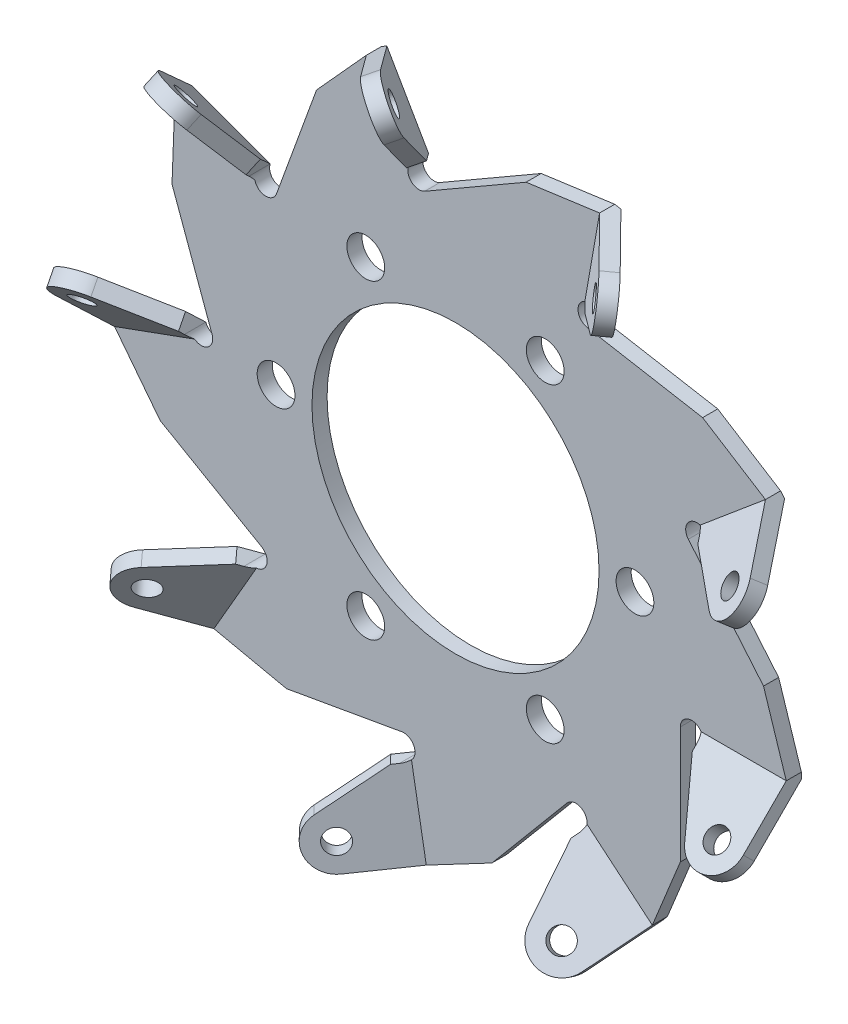
from build123d import *

# Parameters (mm, degrees)
SKETCH_7_R                          = 1.5
EXTRUDE_3_DEPTH                     = 2
PATTERN_CIRCULAR_1_COUNT            = 9
SKETCH_2_R                          = 50
SKETCH_2_R_2                        = 19
SKETCH_2_R_3                        = 2.5
EXTRUDE_1_DEPTH                     = 2
EXTRUDE_2_DEPTH                     = 2
SKETCH_4_R                          = 50
SKETCH_4_R_2                        = 46.106662127
CUT_EXTRUDE_1_DEPTH                 = 2
PATTERN_CIRCULAR_4_COUNT            = 9
OTHER_START                         = 25
OTHER_3_DEPTH                       = 7.880465325
CUT_EXTRUDE_4_REACH                 = 86.785
PATTERN_CIRCULAR_15_COUNT           = 9
CHAMFER_2_SIZE                      = 2
CUT_EXTRUDE_6_REACH                 = 86.785
PATTERN_CIRCULAR_17_COUNT           = 9
CUT_EXTRUDE_7_REACH                 = 86.785
PATTERN_CIRCULAR_19_COUNT           = 9
SKETCH_15_R                         = 8.026911935
CUT_EXTRUDE_9_DEPTH                 = 93.567160054
CUT_EXTRUDE_9_DRAFT                 = -5
PATTERN_CIRCULAR_26_COPY_1_SKETCH_R = 8.026911935
PATTERN_CIRCULAR_26_COPY_1_DEPTH    = 93.567160054
PATTERN_CIRCULAR_26_COPY_1_DRAFT    = -5
PATTERN_CIRCULAR_26_COPY_2_SKETCH_R = 8.026911935
PATTERN_CIRCULAR_26_COPY_2_DEPTH    = 93.567160054
PATTERN_CIRCULAR_26_COPY_2_DRAFT    = -5
PATTERN_CIRCULAR_26_COPY_3_SKETCH_R = 8.026911935
PATTERN_CIRCULAR_26_COPY_3_DEPTH    = 93.567160054
PATTERN_CIRCULAR_26_COPY_3_DRAFT    = -5
PATTERN_CIRCULAR_26_COPY_4_SKETCH_R = 8.026911935
PATTERN_CIRCULAR_26_COPY_4_DEPTH    = 93.567160054
PATTERN_CIRCULAR_26_COPY_4_DRAFT    = -5
PATTERN_CIRCULAR_26_COPY_5_SKETCH_R = 8.026911935
PATTERN_CIRCULAR_26_COPY_5_DEPTH    = 93.567160054
PATTERN_CIRCULAR_26_COPY_5_DRAFT    = -5
PATTERN_CIRCULAR_26_COPY_6_SKETCH_R = 8.026911935
PATTERN_CIRCULAR_26_COPY_6_DEPTH    = 93.567160054
PATTERN_CIRCULAR_26_COPY_6_DRAFT    = -5
PATTERN_CIRCULAR_26_COPY_7_SKETCH_R = 8.026911935
PATTERN_CIRCULAR_26_COPY_7_DEPTH    = 93.567160054
PATTERN_CIRCULAR_26_COPY_7_DRAFT    = -5
PATTERN_CIRCULAR_26_COPY_8_SKETCH_R = 8.026911935
PATTERN_CIRCULAR_26_COPY_8_DEPTH    = 93.567160054
PATTERN_CIRCULAR_26_COPY_8_DRAFT    = -5
SKETCH_14_R                         = 1.5
CUT_EXTRUDE_8_DEPTH                 = 82.855397957
PATTERN_CIRCULAR_27_COUNT           = 9
OTHER_START_2                       = 14.849242405
OTHER_4_OUTLINE_R                   = 2.5
OTHER_4_OUTLINE_R_2                 = 19
OTHER_4_DEPTH                       = 10.150757595


# Read off the part's stored shape, not the designer's step: 交差3, 交差4
with BuildPart() as part:
    # ｽｹｯﾁ1 → 回転1 (revolve)
    with BuildSketch(Plane(origin=(0, 0, 0), x_dir=(-1, 0, 0), z_dir=(0, 0.7071067811865488, 0.7071067811865464))):
        with BuildLine():
            Line((-47.157979176, 23.5), (-40.275, 23.5))
            Line((-40.275, 23.5), (-40.275, -23.5))
            Line((-40.275, -23.5), (-47.157979176, -23.5))
            add(Edge.make_bspline(
                [(-47.157979176, 23.5), (-53.013297933, 0), (-47.157979176, -23.5)],
                knots=[4.373605266, 4.373605266, 4.373605266, 5.051172695, 5.051172695, 5.051172695], degree=2, weights=[1, 0.943159584, 1]))
        make_face()
    revolve(axis=Axis((40.275, -16.617009358, 16.617009358), (0, 0.7071067811865462, -0.7071067811865489)))

    # ｽｹｯﾁ7 → ﾎﾞｽ - 押し出し3 (add)
    with BuildSketch(Plane(origin=(0, -16.617009358, 16.617009358), x_dir=(1, 0, 0), z_dir=(0, -0.7071067811865462, 0.7071067811865488))):
        with Locations(Location((40.275, 0, 0), (0, 0, 270))):
            Circle(SKETCH_7_R)
    extrude_3 = extrude(amount=EXTRUDE_3_DEPTH)

    # ﾐﾗｰ1: ﾎﾞｽ - 押し出し3 across plane
    add(extrude_3.mirror(Plane(origin=(0, 0, 0), x_dir=(0, 0.7071067811865488, 0.7071067811865464), z_dir=(0, -0.7071067811865462, 0.7071067811865488))))


with BuildPart() as pattern_circular_1_1:
    # 円形ﾊﾟﾀｰﾝ1: pattern copy
    add(part.part.rotate(Axis((0, 0, -25.842985085), (0, 0, 1)), 1 * 360 / PATTERN_CIRCULAR_1_COUNT))


with BuildPart() as pattern_circular_1_2:
    # 円形ﾊﾟﾀｰﾝ1: pattern copy
    add(part.part.rotate(Axis((0, 0, -25.842985085), (0, 0, 1)), 2 * 360 / PATTERN_CIRCULAR_1_COUNT))


with BuildPart() as pattern_circular_1_3:
    # 円形ﾊﾟﾀｰﾝ1: pattern copy
    add(part.part.rotate(Axis((0, 0, -25.842985085), (0, 0, 1)), 3 * 360 / PATTERN_CIRCULAR_1_COUNT))


with BuildPart() as pattern_circular_1_4:
    # 円形ﾊﾟﾀｰﾝ1: pattern copy
    add(part.part.rotate(Axis((0, 0, -25.842985085), (0, 0, 1)), 4 * 360 / PATTERN_CIRCULAR_1_COUNT))


with BuildPart() as pattern_circular_1_5:
    # 円形ﾊﾟﾀｰﾝ1: pattern copy
    add(part.part.rotate(Axis((0, 0, -25.842985085), (0, 0, 1)), 5 * 360 / PATTERN_CIRCULAR_1_COUNT))


with BuildPart() as pattern_circular_1_6:
    # 円形ﾊﾟﾀｰﾝ1: pattern copy
    add(part.part.rotate(Axis((0, 0, -25.842985085), (0, 0, 1)), 6 * 360 / PATTERN_CIRCULAR_1_COUNT))


with BuildPart() as pattern_circular_1_7:
    # 円形ﾊﾟﾀｰﾝ1: pattern copy
    add(part.part.rotate(Axis((0, 0, -25.842985085), (0, 0, 1)), 7 * 360 / PATTERN_CIRCULAR_1_COUNT))


with BuildPart() as pattern_circular_1_8:
    # 円形ﾊﾟﾀｰﾝ1: pattern copy
    add(part.part.rotate(Axis((0, 0, -25.842985085), (0, 0, 1)), 8 * 360 / PATTERN_CIRCULAR_1_COUNT))


with BuildPart() as body_10:
    # ｽｹｯﾁ2 → ﾎﾞｽ - 押し出し1 (new body)
    with BuildSketch(Plane.XY.offset(25)):
        Circle(SKETCH_2_R)
        Circle(SKETCH_2_R_2, mode=Mode.SUBTRACT)
        with Locations((-23.75, 0)):
            Circle(SKETCH_2_R_3, mode=Mode.SUBTRACT)
        with Locations((-11.875, 20.56810334)):
            Circle(SKETCH_2_R_3, mode=Mode.SUBTRACT)
        with Locations((11.875, 20.56810334)):
            Circle(SKETCH_2_R_3, mode=Mode.SUBTRACT)
        with Locations((23.75, 0)):
            Circle(SKETCH_2_R_3, mode=Mode.SUBTRACT)
        with Locations((11.875, -20.56810334)):
            Circle(SKETCH_2_R_3, mode=Mode.SUBTRACT)
        with Locations((-11.875, -20.56810334)):
            Circle(SKETCH_2_R_3, mode=Mode.SUBTRACT)
    extrude(amount=-EXTRUDE_1_DEPTH)

    # ｽｹｯﾁ3 → ﾎﾞｽ - 押し出し2 (add)
    with BuildSketch(Plane(origin=(0, -17.324116139, 17.324116139), x_dir=(1, 0, 0), z_dir=(0, -0.7071067811865462, 0.7071067811865488))):
        with BuildLine():
            Line((37.243911087, -1.75), (24.686542732, 20))
            Line((24.686542732, 20), (43.775, 20))
            Line((43.775, 20), (43.775, 0))
            ThreePointArc((43.775, 0), (41.180866658, -3.380740392), (37.243911087, -1.75))
        make_face()
    extrude_2 = extrude(amount=EXTRUDE_2_DEPTH)

    # ｽｹｯﾁ4 → ｶｯﾄ - 押し出し1 (cut)
    with BuildSketch(Plane.XY.offset(25)):
        Circle(SKETCH_4_R)
        Circle(SKETCH_4_R_2, mode=Mode.SUBTRACT)
    extrude(amount=-CUT_EXTRUDE_1_DEPTH, mode=Mode.SUBTRACT)

    # 円形ﾊﾟﾀｰﾝ4: ﾎﾞｽ - 押し出し2 ×9 about axis
    pattern_circular_4_axis = Axis((0, 0, 0), (0, 0, 1))
    for i in range(1, PATTERN_CIRCULAR_4_COUNT):
        add(extrude_2.rotate(pattern_circular_4_axis, i * 360 / PATTERN_CIRCULAR_4_COUNT))

    # Combine 1: union part, 円形ﾊﾟﾀｰﾝ1_1, 円形ﾊﾟﾀｰﾝ1_2, 円形ﾊﾟﾀｰﾝ1_3, 円形ﾊﾟﾀｰﾝ1_4, 円形ﾊﾟﾀｰﾝ1_6, 円形ﾊﾟﾀｰﾝ1_5, 円形ﾊﾟﾀｰﾝ1_8, 円形ﾊﾟﾀｰﾝ1_7
    add(part.part)
    add(pattern_circular_1_1.part)
    add(pattern_circular_1_2.part)
    add(pattern_circular_1_3.part)
    add(pattern_circular_1_4.part)
    add(pattern_circular_1_6.part)
    add(pattern_circular_1_5.part)
    add(pattern_circular_1_8.part)
    add(pattern_circular_1_7.part)

    # 交差3 outline → 交差3 (cut)
    with BuildSketch(Plane.XY.offset(OTHER_START)):
        Polygon((43.775, -15.932797006), (43.775, 15.932797006), (41.553437572, 18.58035201), (35.578933147, 25.700489122), (23.292190994, 40.343258223), (19.888559889, 40.943410219), (10.735088059, 42.55741427), (-8.08929304, 45.876660553), (-11.082396003, 44.148591752), (-19.131824039, 39.501252308), (-35.685706961, 29.943863546), (-36.867775638, 26.696156547), (-40.046743043, 17.962015384), (-46.58438199, 0), (-45.402313312, -3.247707001), (-42.223345907, -11.981848164), (-35.685706961, -29.943863547), (-32.692603997, -31.671932349), (-8.089293042, -45.876660554), (-4.685661934, -45.276508557), (4.467809896, -43.662504506), (23.292190995, -40.343258223), (25.513753423, -37.695703218), (31.488257848, -30.575566106), align=None)
    extrude(amount=OTHER_3_DEPTH, mode=Mode.SUBTRACT)

    # ｽｹｯﾁ9 → ｶｯﾄ - 押し出し4 (cut, up to next)
    with BuildSketch(Plane.XY.offset(25), mode=Mode.PRIVATE) as cut_extrude_4_sk1:
        with BuildLine():
            Line((43.775, -14.476659403), (32.753908888, -14.476659403))
            Line((32.753908888, -14.476659403), (32.753908888, -32.45005))
            ThreePointArc((32.753908888, -32.45005), (39.30558696, -24.101766039), (43.775, -14.476659403))
        make_face()
    cut_extrude_4_tool1 = extrude(cut_extrude_4_sk1.sketch, amount=-CUT_EXTRUDE_4_REACH, mode=Mode.PRIVATE) & body_10.part
    # ｽｹｯﾁ9 → ｶｯﾄ - 押し出し4 (cut, up to next)
    with BuildSketch(Plane.XY.offset(25), mode=Mode.PRIVATE) as cut_extrude_4_sk2:
        with BuildLine():
            Line((43.775, 14.476659403), (43.775, -14.476659403))
            ThreePointArc((43.775, -14.476659403), (45.520014428, -7.331615029), (46.106662127, 0))
            ThreePointArc((46.106662127, 0), (45.520014428, 7.331615029), (43.775, 14.476659403))
        make_face()
    cut_extrude_4_tool2 = extrude(cut_extrude_4_sk2.sketch, amount=-CUT_EXTRUDE_4_REACH, mode=Mode.PRIVATE) & body_10.part
    cut_extrude_4_1 = cut_extrude_4_tool1.solids().sort_by_distance((36.761282, -20.949139, 25))[0]
    add(cut_extrude_4_1, mode=Mode.SUBTRACT)
    cut_extrude_4_2 = cut_extrude_4_tool2.solids().sort_by_distance((44.709716, 0, 25))[0]
    add(cut_extrude_4_2, mode=Mode.SUBTRACT)
    cut_extrude_4 = cut_extrude_4_1 + cut_extrude_4_2  # ｶｯﾄ - 押し出し4 as one shape, for the pattern or mirror that repeats it

    # 円形ﾊﾟﾀｰﾝ15: ｶｯﾄ - 押し出し4 ×9 about axis
    pattern_circular_15_axis = Axis((0, 0, 0), (0, 0, 1))
    for i in range(1, PATTERN_CIRCULAR_15_COUNT):
        add(cut_extrude_4.rotate(pattern_circular_15_axis, i * 360 / PATTERN_CIRCULAR_15_COUNT), mode=Mode.SUBTRACT)

    # 面取り2
    chamfer_2_edges = [body_10.edges().sort_by_distance(p)[0] for p in [
        (-40.908134603, 0.516395821, 25),
        (-31.669382027, -25.899659909, 25),
        (-7.612173634, -40.196976925, 25),
        (20.006855402, -35.685681698, 25),
        (38.264454444, -14.476659403, 25),
        (38.61768999, 13.506152717, 25),
        (20.901279201, 35.169285877, 25),
        (-6.595072417, 40.376319312, 25),
        (-31.005516356, 26.690824208, 25),
    ]]
    chamfer(chamfer_2_edges, length=CHAMFER_2_SIZE - 0.0001)  # a hair under: the kernel refuses the full size

    # ｽｹｯﾁ11 → ｶｯﾄ - 押し出し6 (cut, up to next)
    with BuildSketch(Plane.XY.offset(25), mode=Mode.PRIVATE) as cut_extrude_6_sk1:
        with BuildLine():
            Line((-5.571850447, 34.604046872), (11.892264826, 44.686958525))
            ThreePointArc((11.892264826, 44.686958525), (13.941302931, 44.137920419), (13.392264826, 42.088882314))
            Line((13.392264826, 42.088882314), (-4.071850447, 32.00597066))
            ThreePointArc((-4.071850447, 32.00597066), (-6.120888552, 32.555008766), (-5.571850447, 34.604046872))
        make_face()
    cut_extrude_6_tool1 = extrude(cut_extrude_6_sk1.sketch, amount=-CUT_EXTRUDE_6_REACH, mode=Mode.PRIVATE) & body_10.part
    cut_extrude_6 = cut_extrude_6_tool1.solids().sort_by_distance((3.910207, 38.346465, 25))[0]
    add(cut_extrude_6, mode=Mode.SUBTRACT)

    # 円形ﾊﾟﾀｰﾝ17: ｶｯﾄ - 押し出し6 ×9 about axis
    pattern_circular_17_axis = Axis((0, 0, 0), (0, 0, 1))
    for i in range(1, PATTERN_CIRCULAR_17_COUNT):
        add(cut_extrude_6.rotate(pattern_circular_17_axis, i * 360 / PATTERN_CIRCULAR_17_COUNT), mode=Mode.SUBTRACT)

    # ｽｹｯﾁ13 → ｶｯﾄ - 押し出し7 (cut, up to next)
    with BuildSketch(Plane.XY.offset(25), mode=Mode.PRIVATE) as cut_extrude_7_sk1:
        Polygon((19.072718434, 41.08726508), (13.392264826, 42.088882314), (9.338467933, 39.748421587), align=None)
    cut_extrude_7_tool1 = extrude(cut_extrude_7_sk1.sketch, amount=-CUT_EXTRUDE_7_REACH, mode=Mode.PRIVATE) & body_10.part
    cut_extrude_7 = cut_extrude_7_tool1.solids().sort_by_distance((13.934484, 40.974856, 25))[0]
    add(cut_extrude_7, mode=Mode.SUBTRACT)

    # 円形ﾊﾟﾀｰﾝ19: ｶｯﾄ - 押し出し7 ×9 about axis
    pattern_circular_19_axis = Axis((0, 0, 0), (0, 0, 1))
    for i in range(1, PATTERN_CIRCULAR_19_COUNT):
        add(cut_extrude_7.rotate(pattern_circular_19_axis, i * 360 / PATTERN_CIRCULAR_19_COUNT), mode=Mode.SUBTRACT)


with BuildPart() as cut_extrude_9_tool:
    # ｽｹｯﾁ15 → ｶｯﾄ - 押し出し9 (with draft: the straight prism first)
    with BuildSketch(Plane(origin=(0, -17.324116139, 17.324116139), x_dir=(1, 0, 0), z_dir=(0, 0.7071067811865462, -0.7071067811865488))):
        with Locations((40.275, 0)):
            Circle(SKETCH_15_R)
    extrude(amount=CUT_EXTRUDE_9_DEPTH)
    # ｶｯﾄ - 押し出し9: the draft: its side faces are tilted about the plane it starts from
    cut_extrude_9_sides = [cut_extrude_9_tool.faces().sort_by_distance(p)[0] for p in [
        (32.248088065, 15.756870546, -15.756870546),
    ]]
    draft(cut_extrude_9_sides, Plane(origin=(0, -17.324116139, 17.324116139), x_dir=(1, 0, 0), z_dir=(0, 0.7071067811865462, -0.7071067811865488)), CUT_EXTRUDE_9_DRAFT)


with BuildPart() as body_10_1:
    add(body_10.part)

    # ｶｯﾄ - 押し出し9: cut by cut_extrude_9_tool
    add(cut_extrude_9_tool.part, mode=Mode.SUBTRACT)


with BuildPart() as pattern_circular_26_copy_1_tool:
    # 円形ﾊﾟﾀｰﾝ26 copy 1 sketch → 円形ﾊﾟﾀｰﾝ26 copy 1 (with draft: the straight prism first)
    with BuildSketch(Plane(origin=(11.135727203, -13.2710429, 17.324116139), x_dir=(0.766044443118978, 0.6427876096865393, 0), z_dir=(-0.4545194776720428, 0.5416752204197008, -0.7071067811865488))):
        with Locations((40.275, 0)):
            Circle(PATTERN_CIRCULAR_26_COPY_1_SKETCH_R)
    extrude(amount=PATTERN_CIRCULAR_26_COPY_1_DEPTH)
    # 円形ﾊﾟﾀｰﾝ26 copy 1: the draft: its side faces are tilted about the plane it starts from
    pattern_circular_26_copy_1_sides = [pattern_circular_26_copy_1_tool.faces().sort_by_distance(p)[0] for p in [
        (14.575147509, 32.799134567, -15.756870546),
    ]]
    draft(pattern_circular_26_copy_1_sides, Plane(origin=(11.135727203, -13.2710429, 17.324116139), x_dir=(0.766044443118978, 0.6427876096865393, 0), z_dir=(-0.4545194776720428, 0.5416752204197008, -0.7071067811865488)), PATTERN_CIRCULAR_26_COPY_1_DRAFT)


with BuildPart() as body_10_2:
    add(body_10_1.part)

    # 円形ﾊﾟﾀｰﾝ26 copy 1: cut by pattern_circular_26_copy_1_tool
    add(pattern_circular_26_copy_1_tool.part, mode=Mode.SUBTRACT)


with BuildPart() as pattern_circular_26_copy_2_tool:
    # 円形ﾊﾟﾀｰﾝ26 copy 2 sketch → 円形ﾊﾟﾀｰﾝ26 copy 2 (with draft: the straight prism first)
    with BuildSketch(Plane(origin=(17.060923888, -3.008301197, 17.324116139), x_dir=(0.17364817766693041, 0.984807753012208, 0), z_dir=(-0.6963642403200176, 0.12278780396897267, -0.7071067811865488))):
        with Locations((40.275, 0)):
            Circle(PATTERN_CIRCULAR_26_COPY_2_SKETCH_R)
    extrude(amount=PATTERN_CIRCULAR_26_COPY_2_DEPTH)
    # 円形ﾊﾟﾀｰﾝ26 copy 2: the draft: its side faces are tilted about the plane it starts from
    pattern_circular_26_copy_2_sides = [pattern_circular_26_copy_2_tool.faces().sort_by_distance(p)[0] for p in [
        (-9.917666551, 34.494319002, -15.756870546),
    ]]
    draft(pattern_circular_26_copy_2_sides, Plane(origin=(17.060923888, -3.008301197, 17.324116139), x_dir=(0.17364817766693041, 0.984807753012208, 0), z_dir=(-0.6963642403200176, 0.12278780396897267, -0.7071067811865488)), PATTERN_CIRCULAR_26_COPY_2_DRAFT)


with BuildPart() as body_10_3:
    add(body_10_2.part)

    # 円形ﾊﾟﾀｰﾝ26 copy 2: cut by pattern_circular_26_copy_2_tool
    add(pattern_circular_26_copy_2_tool.part, mode=Mode.SUBTRACT)


with BuildPart() as pattern_circular_26_copy_3_tool:
    # 円形ﾊﾟﾀｰﾝ26 copy 3 sketch → 円形ﾊﾟﾀｰﾝ26 copy 3 (with draft: the straight prism first)
    with BuildSketch(Plane(origin=(15.003124675, 8.66205807, 17.324116139), x_dir=(-0.4999999999999998, 0.8660254037844387, 0), z_dir=(-0.6123724356957935, -0.35355339059327295, -0.7071067811865488))):
        with Locations((40.275, 0)):
            Circle(PATTERN_CIRCULAR_26_COPY_3_SKETCH_R)
    extrude(amount=PATTERN_CIRCULAR_26_COPY_3_DEPTH)
    # 円形ﾊﾟﾀｰﾝ26 copy 3: the draft: its side faces are tilted about the plane it starts from
    pattern_circular_26_copy_3_sides = [pattern_circular_26_copy_3_tool.faces().sort_by_distance(p)[0] for p in [
        (-29.769894209, 20.049228215, -15.756870546),
    ]]
    draft(pattern_circular_26_copy_3_sides, Plane(origin=(15.003124675, 8.66205807, 17.324116139), x_dir=(-0.4999999999999998, 0.8660254037844387, 0), z_dir=(-0.6123724356957935, -0.35355339059327295, -0.7071067811865488)), PATTERN_CIRCULAR_26_COPY_3_DRAFT)


with BuildPart() as body_10_4:
    add(body_10_3.part)

    # 円形ﾊﾟﾀｰﾝ26 copy 3: cut by pattern_circular_26_copy_3_tool
    add(pattern_circular_26_copy_3_tool.part, mode=Mode.SUBTRACT)


with BuildPart() as pattern_circular_26_copy_4_tool:
    # 円形ﾊﾟﾀｰﾝ26 copy 4 sketch → 円形ﾊﾟﾀｰﾝ26 copy 4 (with draft: the straight prism first)
    with BuildSketch(Plane(origin=(5.925196685, 16.279344098, 17.324116139), x_dir=(-0.9396926207859083, 0.3420201433256689, 0), z_dir=(-0.24184476264797491, -0.6644630243886734, -0.7071067811865488))):
        with Locations((40.275, 0)):
            Circle(PATTERN_CIRCULAR_26_COPY_4_SKETCH_R)
    extrude(amount=PATTERN_CIRCULAR_26_COPY_4_DEPTH)
    # 円形ﾊﾟﾀｰﾝ26 copy 4: the draft: its side faces are tilted about the plane it starts from
    pattern_circular_26_copy_4_sides = [pattern_circular_26_copy_4_tool.faces().sort_by_distance(p)[0] for p in [
        (-35.692457512, -3.777119277, -15.756870546),
    ]]
    draft(pattern_circular_26_copy_4_sides, Plane(origin=(5.925196685, 16.279344098, 17.324116139), x_dir=(-0.9396926207859083, 0.3420201433256689, 0), z_dir=(-0.24184476264797491, -0.6644630243886734, -0.7071067811865488)), PATTERN_CIRCULAR_26_COPY_4_DRAFT)


with BuildPart() as body_10_5:
    add(body_10_4.part)

    # 円形ﾊﾟﾀｰﾝ26 copy 4: cut by pattern_circular_26_copy_4_tool
    add(pattern_circular_26_copy_4_tool.part, mode=Mode.SUBTRACT)


with BuildPart() as pattern_circular_26_copy_5_tool:
    # 円形ﾊﾟﾀｰﾝ26 copy 5 sketch → 円形ﾊﾟﾀｰﾝ26 copy 5 (with draft: the straight prism first)
    with BuildSketch(Plane(origin=(-5.925196685, 16.279344098, 17.324116139), x_dir=(-0.9396926207859084, -0.34202014332566866, 0), z_dir=(0.24184476264797478, -0.6644630243886736, -0.7071067811865488))):
        with Locations((40.275, 0)):
            Circle(PATTERN_CIRCULAR_26_COPY_5_SKETCH_R)
    extrude(amount=PATTERN_CIRCULAR_26_COPY_5_DEPTH)
    # 円形ﾊﾟﾀｰﾝ26 copy 5: the draft: its side faces are tilted about the plane it starts from
    pattern_circular_26_copy_5_sides = [pattern_circular_26_copy_5_tool.faces().sort_by_distance(p)[0] for p in [
        (-24.914123267, -25.836110681, -15.756870546),
    ]]
    draft(pattern_circular_26_copy_5_sides, Plane(origin=(-5.925196685, 16.279344098, 17.324116139), x_dir=(-0.9396926207859084, -0.34202014332566866, 0), z_dir=(0.24184476264797478, -0.6644630243886736, -0.7071067811865488)), PATTERN_CIRCULAR_26_COPY_5_DRAFT)


with BuildPart() as body_10_6:
    add(body_10_5.part)

    # 円形ﾊﾟﾀｰﾝ26 copy 5: cut by pattern_circular_26_copy_5_tool
    add(pattern_circular_26_copy_5_tool.part, mode=Mode.SUBTRACT)


with BuildPart() as pattern_circular_26_copy_6_tool:
    # 円形ﾊﾟﾀｰﾝ26 copy 6 sketch → 円形ﾊﾟﾀｰﾝ26 copy 6 (with draft: the straight prism first)
    with BuildSketch(Plane(origin=(-15.003124675, 8.66205807, 17.324116139), x_dir=(-0.5000000000000004, -0.8660254037844384, 0), z_dir=(0.6123724356957932, -0.35355339059327345, -0.7071067811865488))):
        with Locations((40.275, 0)):
            Circle(PATTERN_CIRCULAR_26_COPY_6_SKETCH_R)
    extrude(amount=PATTERN_CIRCULAR_26_COPY_6_DEPTH)
    # 円形ﾊﾟﾀｰﾝ26 copy 6: the draft: its side faces are tilted about the plane it starts from
    pattern_circular_26_copy_6_sides = [pattern_circular_26_copy_6_tool.faces().sort_by_distance(p)[0] for p in [
        (-2.478193856, -35.806098761, -15.756870546),
    ]]
    draft(pattern_circular_26_copy_6_sides, Plane(origin=(-15.003124675, 8.66205807, 17.324116139), x_dir=(-0.5000000000000004, -0.8660254037844384, 0), z_dir=(0.6123724356957932, -0.35355339059327345, -0.7071067811865488)), PATTERN_CIRCULAR_26_COPY_6_DRAFT)


with BuildPart() as body_10_7:
    add(body_10_6.part)

    # 円形ﾊﾟﾀｰﾝ26 copy 6: cut by pattern_circular_26_copy_6_tool
    add(pattern_circular_26_copy_6_tool.part, mode=Mode.SUBTRACT)


with BuildPart() as pattern_circular_26_copy_7_tool:
    # 円形ﾊﾟﾀｰﾝ26 copy 7 sketch → 円形ﾊﾟﾀｰﾝ26 copy 7 (with draft: the straight prism first)
    with BuildSketch(Plane(origin=(-17.060923888, -3.008301197, 17.324116139), x_dir=(0.17364817766692997, -0.9848077530122081, 0), z_dir=(0.6963642403200178, 0.12278780396897236, -0.7071067811865488))):
        with Locations((40.275, 0)):
            Circle(PATTERN_CIRCULAR_26_COPY_7_SKETCH_R)
    extrude(amount=PATTERN_CIRCULAR_26_COPY_7_DEPTH)
    # 円形ﾊﾟﾀｰﾝ26 copy 7: the draft: its side faces are tilted about the plane it starts from
    pattern_circular_26_copy_7_sides = [pattern_circular_26_copy_7_tool.faces().sort_by_distance(p)[0] for p in [
        (21.117310003, -29.02201529, -15.756870546),
    ]]
    draft(pattern_circular_26_copy_7_sides, Plane(origin=(-17.060923888, -3.008301197, 17.324116139), x_dir=(0.17364817766692997, -0.9848077530122081, 0), z_dir=(0.6963642403200178, 0.12278780396897236, -0.7071067811865488)), PATTERN_CIRCULAR_26_COPY_7_DRAFT)


with BuildPart() as body_10_8:
    add(body_10_7.part)

    # 円形ﾊﾟﾀｰﾝ26 copy 7: cut by pattern_circular_26_copy_7_tool
    add(pattern_circular_26_copy_7_tool.part, mode=Mode.SUBTRACT)


with BuildPart() as pattern_circular_26_copy_8_tool:
    # 円形ﾊﾟﾀｰﾝ26 copy 8 sketch → 円形ﾊﾟﾀｰﾝ26 copy 8 (with draft: the straight prism first)
    with BuildSketch(Plane(origin=(-11.135727203, -13.2710429, 17.324116139), x_dir=(0.7660444431189778, -0.6427876096865396, 0), z_dir=(0.45451947767204304, 0.5416752204197007, -0.7071067811865488))):
        with Locations((40.275, 0)):
            Circle(PATTERN_CIRCULAR_26_COPY_8_SKETCH_R)
    extrude(amount=PATTERN_CIRCULAR_26_COPY_8_DEPTH)
    # 円形ﾊﾟﾀｰﾝ26 copy 8: the draft: its side faces are tilted about the plane it starts from
    pattern_circular_26_copy_8_sides = [pattern_circular_26_copy_8_tool.faces().sort_by_distance(p)[0] for p in [
        (34.831789818, -8.658208322, -15.756870546),
    ]]
    draft(pattern_circular_26_copy_8_sides, Plane(origin=(-11.135727203, -13.2710429, 17.324116139), x_dir=(0.7660444431189778, -0.6427876096865396, 0), z_dir=(0.45451947767204304, 0.5416752204197007, -0.7071067811865488)), PATTERN_CIRCULAR_26_COPY_8_DRAFT)


with BuildPart() as body_10_9:
    add(body_10_8.part)

    # 円形ﾊﾟﾀｰﾝ26 copy 8: cut by pattern_circular_26_copy_8_tool
    add(pattern_circular_26_copy_8_tool.part, mode=Mode.SUBTRACT)

    # ｽｹｯﾁ14 → ｶｯﾄ - 押し出し8 (cut, through all)
    with BuildSketch(Plane(origin=(0, -18.738329701, 18.738329701), x_dir=(1, 0, 0), z_dir=(0, -0.7071067811865462, 0.7071067811865488))):
        with Locations(Location((40.275, 0, 0), (0, 0, 270))):
            Circle(SKETCH_14_R)
    cut_extrude_8 = extrude(amount=-CUT_EXTRUDE_8_DEPTH, mode=Mode.SUBTRACT)

    # 円形ﾊﾟﾀｰﾝ27: ｶｯﾄ - 押し出し8 ×9 about axis
    pattern_circular_27_axis = Axis((0, 0, -25.842985085), (0, 0, 1))
    for i in range(1, PATTERN_CIRCULAR_27_COUNT):
        add(cut_extrude_8.rotate(pattern_circular_27_axis, i * 360 / PATTERN_CIRCULAR_27_COUNT), mode=Mode.SUBTRACT)

    # ﾐﾗｰ2: body 10 across plane


with BuildPart() as body_10_10:
    add(body_10_9.part)
    add(body_10_9.part.mirror(Plane.XY.offset(25)))

    # 交差4 outline → 交差4 (cut)
    with BuildSketch(Plane.XY.offset(OTHER_START_2)):
        with BuildLine():
            Line((21.488829339, -42.492420955), (26.046256114, -37.061091223))
            Line((26.046256114, -37.061091223), (29.753908888, -27.961561256))
            Line((29.753908888, -27.961561256), (29.753908888, -12.476659403))
            ThreePointArc((29.753908888, -12.476659403), (31.253908888, -10.976659403), (32.753908888, -12.476659403))
            Line((32.753908888, -12.476659403), (32.753908888, -48))
            Line((32.753908888, -48), (43.775, -48))
            Line((43.775, -48), (43.775, -11.648232278))
            Line((43.775, -11.648232278), (40.766161688, -2.294354648))
            Line((40.766161688, -2.294354648), (30.812658639, 9.567768369))
            ThreePointArc((30.812658639, 9.567768369), (30.997543889, 11.681016448), (33.110791968, 11.496131198))
            Line((33.110791968, 11.496131198), (34.396367188, 9.964042311))
            Line((34.396367188, 9.964042311), (48, -6.248135965))
            Line((48, -6.248135965), (48, 10.897638077))
            Line((48, 10.897638077), (45.578361656, 13.783634273))
            Line((45.578361656, 13.783634273), (41.020934881, 19.214964005))
            Line((41.020934881, 19.214964005), (32.703474368, 24.446405998))
            Line((32.703474368, 24.446405998), (17.453822969, 27.135330987))
            ThreePointArc((17.453822969, 27.135330987), (16.237083605, 28.873014883), (17.974767502, 30.089754246))
            Line((17.974767502, 30.089754246), (19.944383008, 29.74245789))
            Line((19.944383008, 29.74245789), (48, 24.795495644))
            Line((48, 24.795495644), (48, 35.986604861))
            Line((48, 35.986604861), (26.055101346, 39.856082583))
            Line((26.055101346, 39.856082583), (19.072718434, 41.08726508))
            Line((19.072718434, 41.08726508), (9.338467933, 39.748421587))
            Line((9.338467933, 39.748421587), (-4.071850447, 32.00597066))
            ThreePointArc((-4.071850447, 32.00597066), (-6.120888552, 32.555008766), (-5.571850447, 34.604046872))
            Line((-5.571850447, 34.604046872), (-3.839799639, 35.604046872))
            Line((-3.839799639, 35.604046872), (19.3626718, 49))
            Line((19.3626718, 49), (-2.679510428, 49))
            Line((-2.679510428, 49), (-5.659630454, 47.279426901))
            Line((-5.659630454, 47.279426901), (-11.799834938, 43.73437819))
            Line((-11.799834938, 43.73437819), (-18.396111433, 36.45170896))
            Line((-18.396111433, 36.45170896), (-23.692259784, 21.900660955))
            ThreePointArc((-23.692259784, 21.900660955), (-25.61482893, 21.004152239), (-26.511337647, 22.926721385))
            Line((-26.511337647, 22.926721385), (-25.82729736, 24.806106627))
            Line((-25.82729736, 24.806106627), (-17.021440319, 49))
            Line((-17.021440319, 49), (-28.749840511, 49))
            Line((-28.749840511, 49), (-34.726158265, 32.58020192))
            Line((-34.726158265, 32.58020192), (-37.151114402, 25.917689691))
            Line((-37.151114402, 25.917689691), (-37.52294581, 16.098836596))
            Line((-37.52294581, 16.098836596), (-32.226797459, 1.547788591))
            ThreePointArc((-32.226797459, 1.547788591), (-33.123306175, -0.374780556), (-35.045875321, 0.521728161))
            Line((-35.045875321, 0.521728161), (-35.729915608, 2.401113402))
            Line((-35.729915608, 2.401113402), (-49, 38.860370594))
            Line((-49, 38.860370594), (-49, 6.636855936))
            Line((-49, 6.636855936), (-47.543930685, 2.636338372))
            Line((-47.543930685, 2.636338372), (-45.118974548, -4.026173857))
            Line((-45.118974548, -4.026173857), (-39.092376821, -11.786860331))
            Line((-39.092376821, -11.786860331), (-25.682058441, -19.529311257))
            ThreePointArc((-25.682058441, -19.529311257), (-25.133020336, -21.578349363), (-27.182058441, -22.127387469))
            Line((-27.182058441, -22.127387469), (-28.914109249, -21.127387469))
            Line((-28.914109249, -21.127387469), (-49, -9.53079304))
            Line((-49, -9.53079304), (-49, -22.256852877))
            Line((-49, -22.256852877), (-38.115369546, -28.5410972))
            Line((-38.115369546, -28.5410972), (-31.975165062, -32.086145912))
            Line((-31.975165062, -32.086145912), (-22.370050255, -34.157354312))
            Line((-22.370050255, -34.157354312), (-7.120398855, -31.468429324))
            ThreePointArc((-7.120398855, -31.468429324), (-5.382714959, -32.685168687), (-6.599454322, -34.422852583))
            Line((-6.599454322, -34.422852583), (-8.569069828, -34.770148938))
            Line((-8.569069828, -34.770148938), (-49, -41.899212776))
            Line((-49, -41.899212776), (-49, -48))
            Line((-49, -48), (-20.131349444, -48))
            Line((-20.131349444, -48), (-10.852203391, -46.363836193))
            Line((-10.852203391, -46.363836193), (-3.869820479, -45.132653696))
            Line((-3.869820479, -45.132653696), (4.819471442, -40.545242594))
            Line((4.819471442, -40.545242594), (14.77297449, -28.683119577))
            ThreePointArc((14.77297449, -28.683119577), (16.886222569, -28.498234327), (17.07110782, -30.611482406))
            Line((17.07110782, -30.611482406), (15.7855326, -32.143571292))
            Line((15.7855326, -32.143571292), (2.480409111, -48))
            Line((2.480409111, -48), (16.867421794, -48))
            Line((16.867421794, -48), (21.488829339, -42.492420955))
        make_face()
        with Locations((-11.875, -20.56810334)):
            Circle(OTHER_4_OUTLINE_R, mode=Mode.SUBTRACT)
        with Locations((-23.75, 0)):
            Circle(OTHER_4_OUTLINE_R, mode=Mode.SUBTRACT)
        with Locations((11.875, -20.56810334)):
            Circle(OTHER_4_OUTLINE_R, mode=Mode.SUBTRACT)
        Circle(OTHER_4_OUTLINE_R_2, mode=Mode.SUBTRACT)
        with Locations((23.75, 0)):
            Circle(OTHER_4_OUTLINE_R, mode=Mode.SUBTRACT)
        with Locations((-11.875, 20.56810334)):
            Circle(OTHER_4_OUTLINE_R, mode=Mode.SUBTRACT)
        with Locations((11.875, 20.56810334)):
            Circle(OTHER_4_OUTLINE_R, mode=Mode.SUBTRACT)
    extrude(amount=OTHER_4_DEPTH, mode=Mode.SUBTRACT)


solid = body_10_10.part
